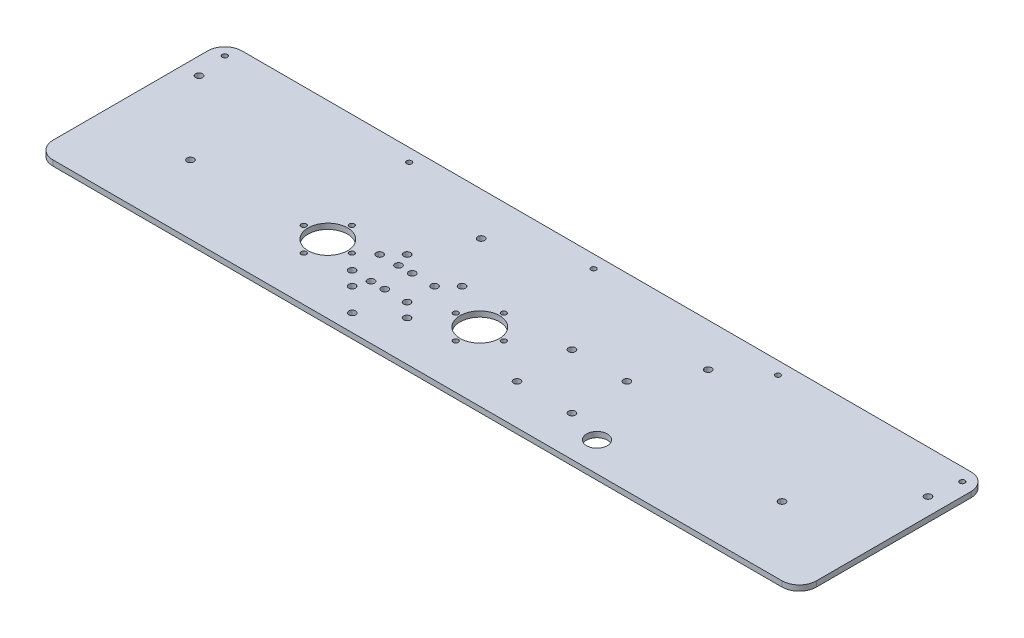
from build123d import *

# Parameters (mm, degrees)
SKETCH1_R           = 2
SKETCH1_R_2         = 1.5
SKETCH1_R_3         = 6
SKETCH1_R_4         = 11.5
BOSS_EXTRUDE1_DEPTH = 3.175
FILLET1_R           = 10
SKETCH2_R           = 2
CUT_EXTRUDE1_DEPTH  = 10
SKETCH3_R           = 2
CUT_EXTRUDE2_DEPTH  = 10


with BuildPart() as part:
    # Sketch1 → Boss-Extrude1 (new body)
    with BuildSketch(Plane(origin=(0, 0, 0), x_dir=(1, 0, 0), z_dir=(0, 1, 0))):
        Polygon((-26.799577535, 0), (417.700422465, 0), (417.700422465, 17.22815868), (417.700422465, 110), (-26.799577535, 110), align=None)
        with Locations((23.200422465, 40)):
            Circle(SKETCH1_R, mode=Mode.SUBTRACT)
        with Locations((89.200422465, 40)):
            Circle(SKETCH1_R_2, mode=Mode.SUBTRACT)
        with Locations((103.200422465, 26)):
            Circle(SKETCH1_R_2, mode=Mode.SUBTRACT)
        with Locations((117.200422465, 40)):
            Circle(SKETCH1_R_2, mode=Mode.SUBTRACT)
        with Locations((177.700422465, 40)):
            Circle(SKETCH1_R_2, mode=Mode.SUBTRACT)
        with Locations((191.700422465, 26)):
            Circle(SKETCH1_R_2, mode=Mode.SUBTRACT)
        with Locations((205.700422465, 40)):
            Circle(SKETCH1_R_2, mode=Mode.SUBTRACT)
        with Locations((367.700422465, 40)):
            Circle(SKETCH1_R, mode=Mode.SUBTRACT)
        with Locations((147.450422465, 10)):
            Circle(SKETCH1_R, mode=Mode.SUBTRACT)
        with Locations((282.700422465, 17.22815868)):
            Circle(SKETCH1_R_3, mode=Mode.SUBTRACT)
        with Locations((-16.799577535, 85)):
            Circle(SKETCH1_R, mode=Mode.SUBTRACT)
        with Locations((147.450422465, 85)):
            Circle(SKETCH1_R, mode=Mode.SUBTRACT)
        with Locations((103.200422465, 54)):
            Circle(SKETCH1_R_2, mode=Mode.SUBTRACT)
        with Locations((103.200422465, 40)):
            Circle(SKETCH1_R_4, mode=Mode.SUBTRACT)
        with Locations((279.700422465, 85)):
            Circle(SKETCH1_R, mode=Mode.SUBTRACT)
        with Locations((191.700422465, 54)):
            Circle(SKETCH1_R_2, mode=Mode.SUBTRACT)
        with Locations((191.700422465, 40)):
            Circle(SKETCH1_R_4, mode=Mode.SUBTRACT)
        with Locations((407.700422465, 85)):
            Circle(SKETCH1_R, mode=Mode.SUBTRACT)
        with Locations((-19.299577535, 102.5)):
            Circle(SKETCH1_R_2, mode=Mode.SUBTRACT)
        with Locations((88.075422465, 102.5)):
            Circle(SKETCH1_R_2, mode=Mode.SUBTRACT)
        with Locations((195.450422465, 102.5)):
            Circle(SKETCH1_R_2, mode=Mode.SUBTRACT)
        with Locations((302.825422465, 102.5)):
            Circle(SKETCH1_R_2, mode=Mode.SUBTRACT)
        with Locations((410.200422465, 102.5)):
            Circle(SKETCH1_R_2, mode=Mode.SUBTRACT)
    extrude(amount=BOSS_EXTRUDE1_DEPTH)

    # Fillet1
    fillet1_edges = [part.edges().sort_by_distance(p)[0] for p in [
        (417.700422465, 1.5875, -110),
        (417.700422465, 1.5875, 0),
        (-26.799577535, 1.5875, 0),
        (-26.799577535, 1.5875, -110),
    ]]
    fillet(fillet1_edges, radius=FILLET1_R)

    # Sketch2 → Cut-Extrude1 (cut)
    with BuildSketch(Plane(origin=(0, 3.175, 0), x_dir=(1, 0, 0), z_dir=(0, 1, 0))):
        with Locations((133.950422465, 55.40559892)):
            Circle(SKETCH2_R)
        with Locations((165.950422465, 55.40559892)):
            Circle(SKETCH2_R)
        with Locations((133.950422465, 23.40559892)):
            Circle(SKETCH2_R)
        with Locations((165.950422465, 23.40559892)):
            Circle(SKETCH2_R)
        with Locations((157.950422465, 31.40559892)):
            Circle(SKETCH2_R)
        with Locations((125.950422465, 31.40559892)):
            Circle(SKETCH2_R)
        with Locations((125.950422465, 47.40559892)):
            Circle(SKETCH2_R)
        with Locations((157.950422465, 47.40559892)):
            Circle(SKETCH2_R)
    extrude(amount=-CUT_EXTRUDE1_DEPTH, mode=Mode.SUBTRACT)

    # Sketch3 → Cut-Extrude2 (cut)
    with BuildSketch(Plane.XZ):
        with Locations((136.950422465, -47.40559892)):
            Circle(SKETCH3_R)
        with Locations((144.950422465, -31.40559892)):
            Circle(SKETCH3_R)
        with Locations((136.950422465, -31.40559892)):
            Circle(SKETCH3_R)
        with Locations((144.950422465, -47.40559892)):
            Circle(SKETCH3_R)
        with Locations((229.950422465, -55.40559892)):
            Circle(SKETCH3_R)
        with Locations((229.950422465, -23.40559892)):
            Circle(SKETCH3_R)
        with Locations((261.950422465, -23.40559892)):
            Circle(SKETCH3_R)
        with Locations((261.950422465, -55.40559892)):
            Circle(SKETCH3_R)
    extrude(amount=-CUT_EXTRUDE2_DEPTH, mode=Mode.SUBTRACT)


solid = part.part
